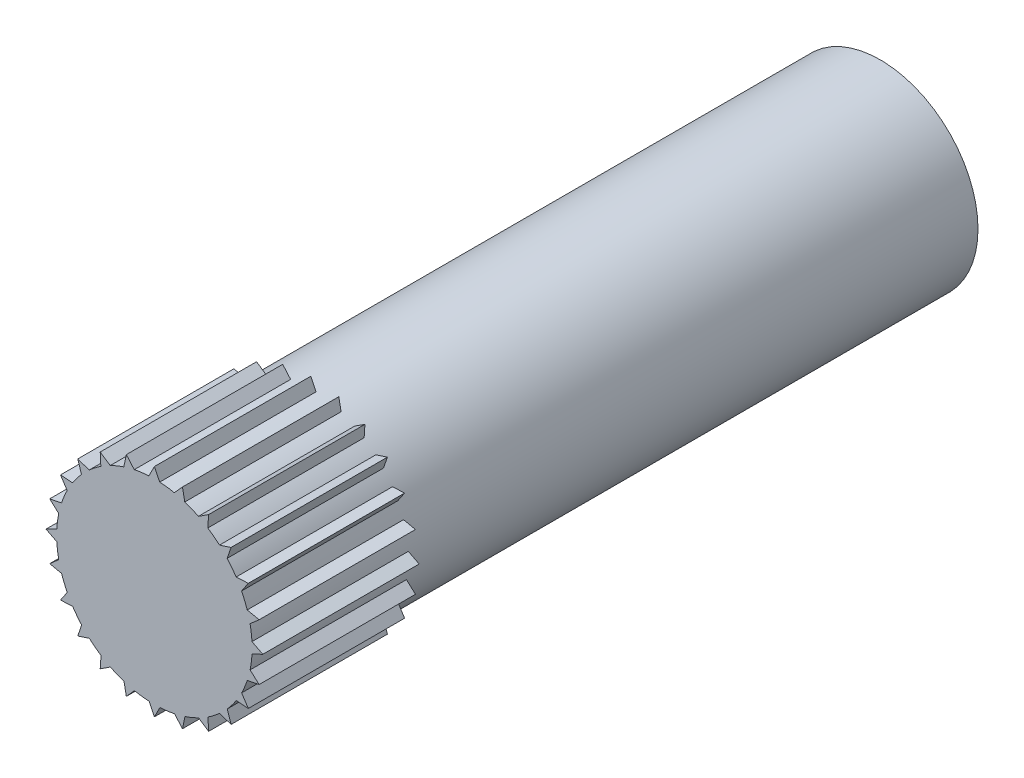
from build123d import *

# Parameters (mm, degrees)
SKETCH1_R           = 1.75
BOSS_EXTRUDE1_DEPTH = 13
BOSS_EXTRUDE2_START = -2.8
BOSS_EXTRUDE2_DEPTH = 2.8
CIRPATTERN1_START   = 10.2
CIRPATTERN1_DEPTH   = 2.8


# Read off the part's stored shape, not the designer's step: CirPattern1
with BuildPart() as part:
    # Sketch1 → Boss-Extrude1 (new body)
    with BuildSketch(Plane.XY):
        with Locations(Location((0, 0, 0), (0, 0, 180))):
            Circle(SKETCH1_R)
    extrude(amount=BOSS_EXTRUDE1_DEPTH)

    # Sketch2 → Boss-Extrude2 (add)
    with BuildSketch(Plane.XY.offset(13).offset(BOSS_EXTRUDE2_START)):
        with BuildLine():
            Line((0.095027487, 1.747418031), (0, 1.941449497))
            Line((0, 1.941449497), (-0.099072162, 1.74719338))
            ThreePointArc((-0.099072162, 1.74719338), (-0.002025455, 1.749998828), (0.095027487, 1.747418031))
        make_face()
    extrude(amount=BOSS_EXTRUDE2_DEPTH)

    # CirPattern1 outline → CirPattern1 (add)
    with BuildSketch(Plane.XY.offset(CIRPATTERN1_START)):
        with BuildLine():
            Line((-0.360475563, 1.712471129), (-0.502484105, 1.87529621))
            Line((-0.502484105, 1.87529621), (-0.547903282, 1.662017447))
            ThreePointArc((-0.547903282, 1.662017447), (-0.454889465, 1.689844838), (-0.360475563, 1.712471129))
        make_face()
        with BuildLine():
            Line((0.502484105, 1.87529621), (0.356510562, 1.713300972))
            ThreePointArc((0.356510562, 1.713300972), (0.450976586, 1.69089329), (0.54405457, 1.663281283))
            Line((0.54405457, 1.663281283), (0.502484105, 1.87529621))
        make_face()
        with BuildLine():
            ThreePointArc((-0.959395699, 1.463577771), (-0.876753509, 1.514530714), (-0.791412798, 1.56082215))
            Line((-0.791412798, 1.56082215), (-0.970724749, 1.681344585))
            Line((-0.970724749, 1.681344585), (-0.959395699, 1.463577771))
        make_face()
        with BuildLine():
            Line((0.970724749, 1.681344585), (0.787797681, 1.562649933))
            ThreePointArc((0.787797681, 1.562649933), (0.873245319, 1.516556169), (0.956005233, 1.465794663))
            Line((0.956005233, 1.465794663), (0.970724749, 1.681344585))
        make_face()
        with BuildLine():
            ThreePointArc((-1.305506884, 1.165397689), (-1.238868251, 1.236003826), (-1.168416559, 1.30280572))
            Line((-1.168416559, 1.30280572), (-1.372812105, 1.372812105))
            Line((-1.372812105, 1.372812105), (-1.305506884, 1.165397689))
        make_face()
        with BuildLine():
            Line((1.372812105, 1.372812105), (1.165397689, 1.305506884))
            ThreePointArc((1.165397689, 1.305506884), (1.236003826, 1.238868251), (1.30280572, 1.168416559))
            Line((1.30280572, 1.168416559), (1.372812105, 1.372812105))
        make_face()
        with BuildLine():
            ThreePointArc((-1.562649933, 0.787797681), (-1.516556169, 0.873245319), (-1.465794663, 0.956005233))
            Line((-1.465794663, 0.956005233), (-1.681344585, 0.970724749))
            Line((-1.681344585, 0.970724749), (-1.562649933, 0.787797681))
        make_face()
        with BuildLine():
            Line((1.681344585, 0.970724749), (1.463577771, 0.959395699))
            ThreePointArc((1.463577771, 0.959395699), (1.514530714, 0.876753509), (1.56082215, 0.791412798))
            Line((1.56082215, 0.791412798), (1.681344585, 0.970724749))
        make_face()
        with BuildLine():
            ThreePointArc((-1.713300972, 0.356510562), (-1.69089329, 0.450976586), (-1.663281283, 0.54405457))
            Line((-1.663281283, 0.54405457), (-1.87529621, 0.502484105))
            Line((-1.87529621, 0.502484105), (-1.713300972, 0.356510562))
        make_face()
        with BuildLine():
            Line((1.87529621, 0.502484105), (1.662017447, 0.547903282))
            ThreePointArc((1.662017447, 0.547903282), (1.689844838, 0.454889465), (1.712471129, 0.360475563))
            Line((1.712471129, 0.360475563), (1.87529621, 0.502484105))
        make_face()
        with BuildLine():
            ThreePointArc((-1.74719338, -0.099072162), (-1.749998828, -0.002025455), (-1.747418031, 0.095027487))
            Line((-1.747418031, 0.095027487), (-1.941449497, 0))
            Line((-1.941449497, 0), (-1.74719338, -0.099072162))
        make_face()
        with BuildLine():
            Line((1.941449497, 0), (1.74719338, 0.099072162))
            ThreePointArc((1.74719338, 0.099072162), (1.749998828, 0.002025455), (1.747418031, -0.095027487))
            Line((1.747418031, -0.095027487), (1.941449497, 0))
        make_face()
        with BuildLine():
            ThreePointArc((-1.662017447, -0.547903282), (-1.689844838, -0.454889465), (-1.712471129, -0.360475563))
            Line((-1.712471129, -0.360475563), (-1.87529621, -0.502484105))
            Line((-1.87529621, -0.502484105), (-1.662017447, -0.547903282))
        make_face()
        with BuildLine():
            ThreePointArc((-1.463577771, -0.959395699), (-1.514530714, -0.876753509), (-1.56082215, -0.791412798))
            Line((-1.56082215, -0.791412798), (-1.681344585, -0.970724749))
            Line((-1.681344585, -0.970724749), (-1.463577771, -0.959395699))
        make_face()
        with BuildLine():
            Line((1.87529621, -0.502484105), (1.713300972, -0.356510562))
            ThreePointArc((1.713300972, -0.356510562), (1.69089329, -0.450976586), (1.663281283, -0.54405457))
            Line((1.663281283, -0.54405457), (1.87529621, -0.502484105))
        make_face()
        with BuildLine():
            ThreePointArc((-1.165397689, -1.305506884), (-1.236003826, -1.238868251), (-1.30280572, -1.168416559))
            Line((-1.30280572, -1.168416559), (-1.372812105, -1.372812105))
            Line((-1.372812105, -1.372812105), (-1.165397689, -1.305506884))
        make_face()
        with BuildLine():
            Line((1.681344585, -0.970724749), (1.562649933, -0.787797681))
            ThreePointArc((1.562649933, -0.787797681), (1.516556169, -0.873245319), (1.465794663, -0.956005233))
            Line((1.465794663, -0.956005233), (1.681344585, -0.970724749))
        make_face()
        with BuildLine():
            ThreePointArc((-0.787797681, -1.562649933), (-0.873245319, -1.516556169), (-0.956005233, -1.465794663))
            Line((-0.956005233, -1.465794663), (-0.970724749, -1.681344585))
            Line((-0.970724749, -1.681344585), (-0.787797681, -1.562649933))
        make_face()
        with BuildLine():
            Line((1.372812105, -1.372812105), (1.305506884, -1.165397689))
            ThreePointArc((1.305506884, -1.165397689), (1.238868251, -1.236003826), (1.168416559, -1.30280572))
            Line((1.168416559, -1.30280572), (1.372812105, -1.372812105))
        make_face()
        with BuildLine():
            ThreePointArc((-0.356510562, -1.713300972), (-0.450976586, -1.69089329), (-0.54405457, -1.663281283))
            Line((-0.54405457, -1.663281283), (-0.502484105, -1.87529621))
            Line((-0.502484105, -1.87529621), (-0.356510562, -1.713300972))
        make_face()
        with BuildLine():
            Line((0.970724749, -1.681344585), (0.959395699, -1.463577771))
            ThreePointArc((0.959395699, -1.463577771), (0.876753509, -1.514530714), (0.791412798, -1.56082215))
            Line((0.791412798, -1.56082215), (0.970724749, -1.681344585))
        make_face()
        with BuildLine():
            ThreePointArc((0.099072162, -1.74719338), (0.002025455, -1.749998828), (-0.095027487, -1.747418031))
            Line((-0.095027487, -1.747418031), (0, -1.941449497))
            Line((0, -1.941449497), (0.099072162, -1.74719338))
        make_face()
        with BuildLine():
            Line((0.502484105, -1.87529621), (0.547903282, -1.662017447))
            ThreePointArc((0.547903282, -1.662017447), (0.454889465, -1.689844838), (0.360475563, -1.712471129))
            Line((0.360475563, -1.712471129), (0.502484105, -1.87529621))
        make_face()
    extrude(amount=CIRPATTERN1_DEPTH)


solid = part.part
